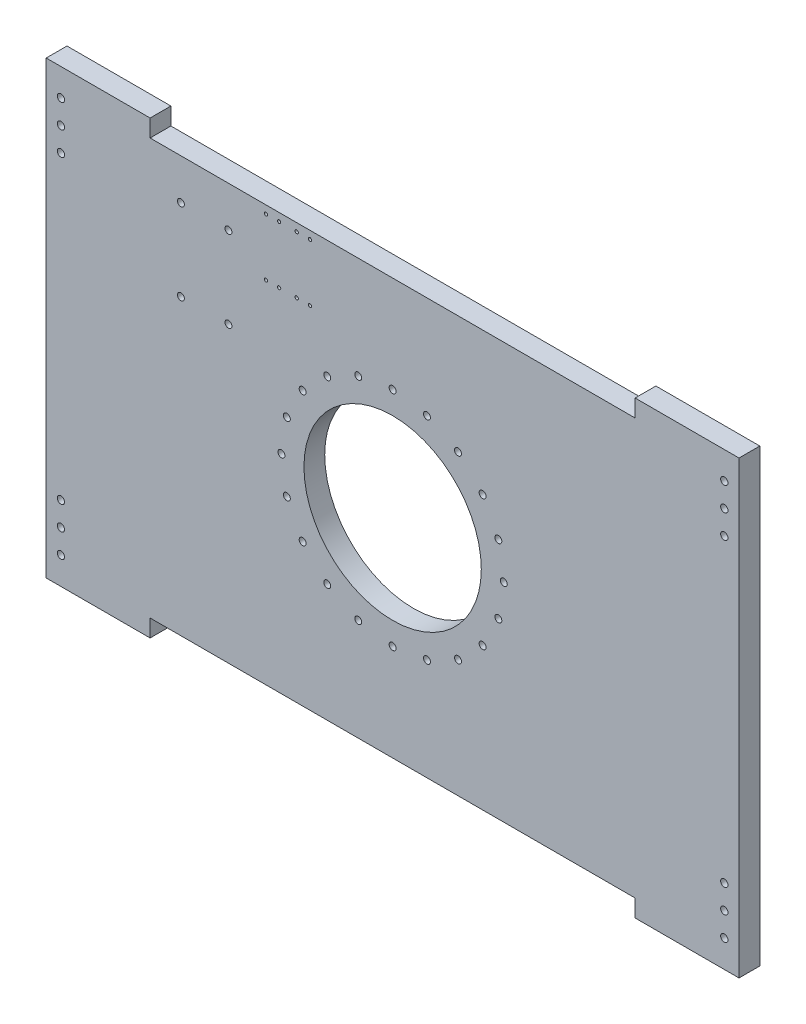
from build123d import *

# Parameters (mm, degrees)
BOSS_EXTRU_1_DEPTH           = 60
ESQUISSE2_R                  = 256
ENL_V_MAT_EXTRU_1_DEPTH      = 1602.905115792
ESQUISSE5_R                  = 10
ENL_V_MAT_EXTRU_3_DEPTH      = 1602.905115792
R_P_TITION_CIRCULAIRE1_COUNT = 20
ESQUISSE6_R                  = 10.5
ENL_V_MAT_EXTRU_4_DEPTH      = 1602.905115792
ENL_V_MAT_EXTRU_5_DEPTH      = 1602.905115792
ENL_V_MAT_EXTRU_5_DEPTH_BACK = 100
ESQUISSE11_R                 = 10
ESQUISSE12_R                 = 4.7625
ESQUISSE12_R_2               = 4.764130996
ENL_V_MAT_EXTRU_6_DEPTH      = 100


with BuildPart() as part:
    # Esquisse1 → Boss.-Extru.1 (new body)
    with BuildSketch(Plane.XY):
        Polygon((-1000, 1250), (-700, 1250), (-700, 1200), (700, 1200), (700, 1250), (1000, 1250), (1000, -50), (700, -50), (700, 0), (-700, 0), (-700, -50), (-1000, -50), align=None)
    extrude(amount=BOSS_EXTRU_1_DEPTH)

    # Esquisse2 → Enlèv. mat.-Extru.1 (cut, through all)
    with BuildSketch(Plane.XY.offset(60)):
        with Locations((0, 600)):
            Circle(ESQUISSE2_R)
    extrude(amount=-ENL_V_MAT_EXTRU_1_DEPTH, mode=Mode.SUBTRACT)

    # Esquisse5 → Enlèv. mat.-Extru.3 (cut, through all)
    with BuildSketch(Plane.XY):
        with Locations((0, 921)):
            Circle(ESQUISSE5_R)
    enl_v_mat_extru_3 = extrude(amount=ENL_V_MAT_EXTRU_3_DEPTH, mode=Mode.SUBTRACT)

    # Répétition circulaire1: Enlèv. mat.-Extru.3 ×20 about axis
    r_p_tition_circulaire1_axis = Axis((0, 600, 0), (0, 0, -1))
    for i in range(1, R_P_TITION_CIRCULAIRE1_COUNT):
        add(enl_v_mat_extru_3.rotate(r_p_tition_circulaire1_axis, i * 360 / R_P_TITION_CIRCULAIRE1_COUNT), mode=Mode.SUBTRACT)

    # Esquisse6 → Enlèv. mat.-Extru.4 (cut, through all)
    with BuildSketch(Plane(origin=(0, 0, 0), x_dir=(-1, 0, 0), z_dir=(0, 0, -1))):
        with Locations((-957.5, 28.75)):
            Circle(ESQUISSE6_R)
        with Locations((-957.5, 1171.25)):
            Circle(ESQUISSE6_R)
        with Locations((957.5, 1171.25)):
            Circle(ESQUISSE6_R)
        with Locations((957.5, 28.75)):
            Circle(ESQUISSE6_R)
        with Locations((-957.5, 97.5)):
            Circle(ESQUISSE6_R)
        with Locations((-957.5, 166.25)):
            Circle(ESQUISSE6_R)
        with Locations((-957.5, 1033.75)):
            Circle(ESQUISSE6_R)
        with Locations((-957.5, 1102.5)):
            Circle(ESQUISSE6_R)
        with Locations((957.5, 97.5)):
            Circle(ESQUISSE6_R)
        with Locations((957.5, 166.25)):
            Circle(ESQUISSE6_R)
        with Locations((957.5, 1102.5)):
            Circle(ESQUISSE6_R)
        with Locations((957.5, 1033.75)):
            Circle(ESQUISSE6_R)
    extrude(amount=-ENL_V_MAT_EXTRU_4_DEPTH, mode=Mode.SUBTRACT)

    # Esquisse11 → Enlèv. mat.-Extru.5 (cut, two sides: drawn at the far end of the back side and taken through both)
    with BuildSketch(Plane(origin=(0, 0, 0), x_dir=(-1, 0, 0), z_dir=(0, 0, -1)).offset(-ENL_V_MAT_EXTRU_5_DEPTH_BACK)):
        with Locations((473.85, 847.499999527)):
            Circle(ESQUISSE11_R)
        with Locations((611.15, 847.499999527)):
            Circle(ESQUISSE11_R)
        with Locations((611.15, 1082.5)):
            Circle(ESQUISSE11_R)
        with Locations((473.85, 1082.5)):
            Circle(ESQUISSE11_R)
    extrude(amount=ENL_V_MAT_EXTRU_5_DEPTH + ENL_V_MAT_EXTRU_5_DEPTH_BACK, mode=Mode.SUBTRACT)

    # Esquisse12 → Enlèv. mat.-Extru.6 (cut)
    with BuildSketch(Plane(origin=(0, 0, 0), x_dir=(-1, 0, 0), z_dir=(0, 0, -1))):
        with Locations((238.748120078, 1177.125064527)):
            Circle(ESQUISSE12_R)
        with Locations((327.648120078, 1177.125064527)):
            Circle(ESQUISSE12_R)
        with Locations((238.748120078, 1012.025064527)):
            Circle(ESQUISSE12_R)
        with Locations((276.848120078, 1012.025064527)):
            Circle(ESQUISSE12_R)
        with Locations((327.648120078, 1012.025064527)):
            Circle(ESQUISSE12_R_2)
        with Locations((365.748120078, 1012.025064527)):
            Circle(ESQUISSE12_R)
        with Locations((365.748120078, 1177.125064527)):
            Circle(ESQUISSE12_R)
        with Locations((276.848120078, 1177.125064527)):
            Circle(ESQUISSE12_R)
    extrude(amount=-ENL_V_MAT_EXTRU_6_DEPTH, mode=Mode.SUBTRACT)


solid = part.part
